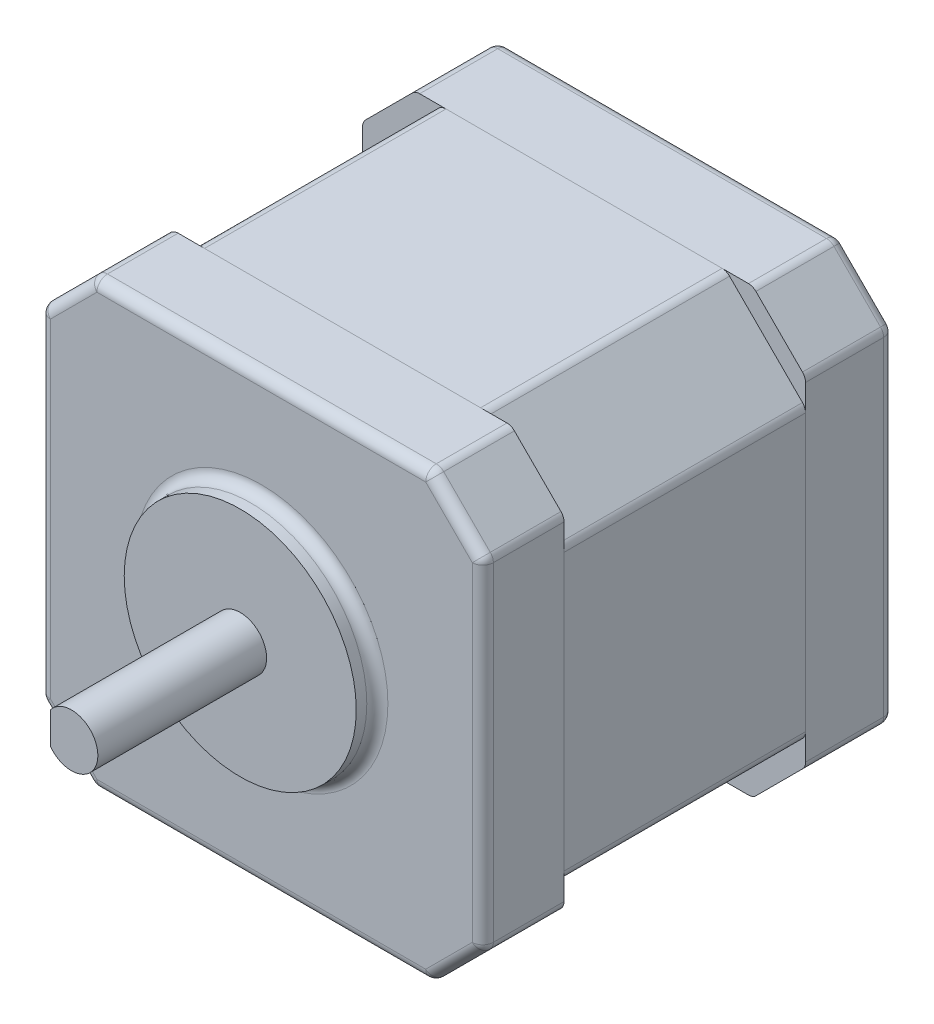
from build123d import *

# Parameters (mm, degrees)
SKETCH1_W           = 42
SKETCH1_H           = 42
BOSS_EXTRUDE1_DEPTH = 19.5
CUT_EXTRUDE1_START  = -7.7
CUT_EXTRUDE1_DEPTH  = 22.9
SKETCH3_R           = 11
BOSS_EXTRUDE2_DEPTH = 2
CHAMFER1_SIZE       = 5
FILLET1_R           = 1
BOSS_EXTRUDE3_DEPTH = 16


with BuildPart() as part:
    # Sketch1 → Boss-Extrude1 (new, symmetric)
    with BuildSketch(Plane.XY):
        Rectangle(SKETCH1_W, SKETCH1_H)
    extrude(amount=BOSS_EXTRUDE1_DEPTH, both=True)

    # Sketch2 → Cut-Extrude1 (cut)
    with BuildSketch(Plane.XY.offset(19.5).offset(CUT_EXTRUDE1_START)):
        Polygon((-21, 21), (-13.5, 21), (-21, 13.5), align=None)
        Polygon((13.5, 21), (21, 21), (21, 13.5), align=None)
        Polygon((21, -13.5), (21, -21), (13.5, -21), align=None)
        Polygon((-13.5, -21), (-21, -21), (-21, -13.5), align=None)
    extrude(amount=-CUT_EXTRUDE1_DEPTH, mode=Mode.SUBTRACT)

    # Sketch3 → Boss-Extrude2 (add)
    with BuildSketch(Plane.XY.offset(19.5)):
        Circle(SKETCH3_R)
    extrude(amount=BOSS_EXTRUDE2_DEPTH)

    # Chamfer1
    chamfer1_edges = [part.edges().sort_by_distance(p)[0] for p in [
        (21, 21, -15.3),
        (21, 21, 15.65),
        (21, -21, 15.65),
        (21, -21, -15.3),
        (-21, 21, -15.3),
        (-21, -21, -15.3),
        (-21, -21, 15.65),
        (-21, 21, 15.65),
    ]]
    chamfer(chamfer1_edges, length=CHAMFER1_SIZE)

    # Fillet1
    fillet1_edges = [part.edges().sort_by_distance(p)[0] for p in [
        (-18.5, 18.5, -19.5),
        (-21, 0, -19.5),
        (-18.5, -18.5, -19.5),
        (0, -21, -19.5),
        (18.5, -18.5, -19.5),
        (21, 0, -19.5),
        (18.5, 18.5, -19.5),
        (0, 21, -19.5),
        (18.5, -18.5, 19.5),
        (0, -21, 19.5),
        (-18.5, -18.5, 19.5),
        (-21, 0, 19.5),
        (-18.5, 18.5, 19.5),
        (0, 21, 19.5),
        (18.5, 18.5, 19.5),
        (21, 0, 19.5),
        (-11, 0, 19.5),
        (-21, 16, 15.65),
        (-16, 21, 15.65),
        (-16, 21, -15.3),
        (-21, 16, -15.3),
        (-21, 13.5, 0.35),
        (-13.5, 21, 0.35),
        (16, 21, 15.65),
        (21, 16, 15.65),
        (21, 16, -15.3),
        (16, 21, -15.3),
        (13.5, 21, 0.35),
        (21, 13.5, 0.35),
        (21, -16, 15.65),
        (16, -21, 15.65),
        (21, -13.5, 0.35),
        (13.5, -21, 0.35),
        (16, -21, -15.3),
        (21, -16, -15.3),
        (-16, -21, -15.3),
        (-21, -16, -15.3),
        (-13.5, -21, 0.35),
        (-21, -13.5, 0.35),
        (-21, -16, 15.65),
        (-16, -21, 15.65),
    ]]
    fillet(fillet1_edges, radius=FILLET1_R)

    # Sketch4 → Boss-Extrude3 (add)
    with BuildSketch(Plane.XY.offset(21.5)):
        with BuildLine():
            Line((-2, -1.5), (-2, 1.5))
            ThreePointArc((-2, 1.5), (2.5, 0), (-2, -1.5))
        make_face()
    extrude(amount=BOSS_EXTRUDE3_DEPTH)


solid = part.part
